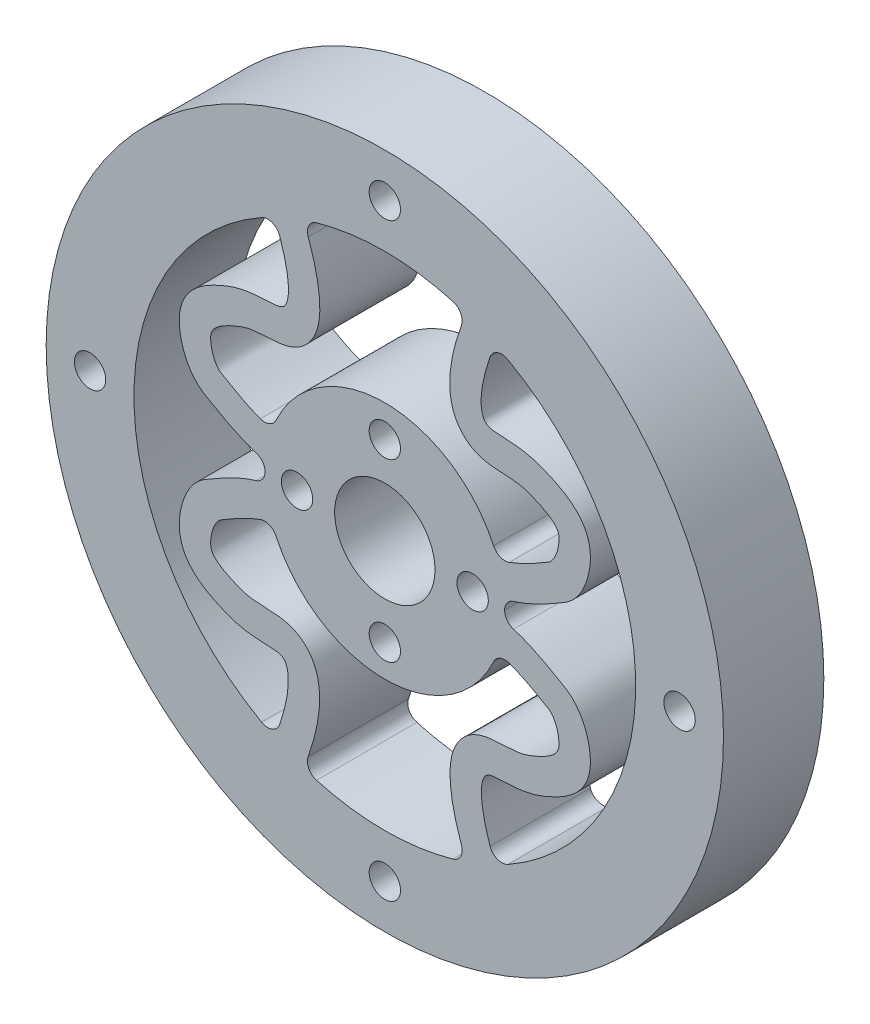
from build123d import *

# Parameters (mm, degrees)
BOSS_EXTRUDE1_OUTLINE_R   = 27
BOSS_EXTRUDE1_OUTLINE_R_2 = 1.25
BOSS_EXTRUDE1_OUTLINE_R_3 = 4
BOSS_EXTRUDE1_DEPTH       = 8
FILLET1_R                 = 1


# Read off the part's stored shape, not the designer's step: Boss-Extrude1
with BuildPart() as part:
    # Boss-Extrude1 outline → Boss-Extrude1 (new body)
    with BuildSketch(Plane.XY):
        Circle(BOSS_EXTRUDE1_OUTLINE_R)
        with Locations((0, -23.5)):
            Circle(BOSS_EXTRUDE1_OUTLINE_R_2, mode=Mode.SUBTRACT)
        with BuildLine():
            add(Edge.make_bspline(
                [(6.483801843, -18.919839155), (6.480612205, -18.912032776), (6.441503957, -18.816167051), (6.347612357, -18.58122213), (6.119029267, -17.980388927), (5.789810817, -17.013794353), (5.429669957, -15.668496809), (5.191806498, -14.230135337), (5.175407974, -12.761834066), (5.524401823, -11.283291588), (6.409718684, -10.166991751), (7.454125678, -9.625091073), (8.350033292, -9.42542645), (9.170309196, -9.376479516), (9.947678619, -9.350570154), (10.675240534, -9.288463207), (11.237211138, -9.169079776), (11.932036453, -8.89638821), (12.637697815, -8.576891164), (13.211834821, -8.233451201), (13.613150576, -7.882315625), (13.813065964, -7.569945647), (13.896838471, -7.281813359), (13.879539964, -6.641593544), (13.73039878, -6.059941379), (13.55175681, -5.653270156), (13.396702845, -5.396835282), (13.265283039, -5.238744867), (13.160626685, -5.14359219), (13.101918554, -5.098485448), (12.979648753, -5.022079201), (12.577995362, -4.7934595), (11.724742054, -4.291783433), (10.601060528, -3.730602471), (9.652508015, -3.377233049), (9.21951845, -3.260097231), (8.993066806, -3.214723866)],
                knots=[0.007762367, 0.007762367, 0.007762367, 0.007762367, 0.009702959, 0.03125, 0.0625, 0.125, 0.1875, 0.25, 0.3125, 0.375, 0.4375, 0.46875, 0.5, 0.53125, 0.5625, 0.59375, 0.625, 0.65625, 0.6875, 0.71875, 0.75, 0.78125, 0.8125, 0.84375, 0.875, 0.890625, 0.90625, 0.921875, 0.9296875, 0.9375, 0.9453125, 0.953125, 0.96875, 0.984375, 0.9921875, 1, 1, 1, 1], degree=3))
            ThreePointArc((6.483801843, -18.919839155), (0, -20), (-6.483801843, -18.919839155))
            add(Edge.make_bspline(
                [(-6.483801843, -18.919839155), (-6.480612205, -18.912032776), (-6.441503957, -18.816167051), (-6.347612357, -18.58122213), (-6.119029267, -17.980388927), (-5.789810817, -17.013794353), (-5.429669957, -15.668496809), (-5.191806498, -14.230135337), (-5.175407974, -12.761834066), (-5.524401823, -11.283291588), (-6.409718684, -10.166991751), (-7.454125678, -9.625091073), (-8.350033292, -9.42542645), (-9.170309196, -9.376479516), (-9.947678619, -9.350570154), (-10.675240534, -9.288463207), (-11.237211138, -9.169079776), (-11.932036453, -8.89638821), (-12.637697815, -8.576891164), (-13.211834821, -8.233451201), (-13.613150576, -7.882315625), (-13.813065964, -7.569945647), (-13.896838471, -7.281813359), (-13.879539964, -6.641593544), (-13.73039878, -6.059941379), (-13.55175681, -5.653270156), (-13.396702845, -5.396835282), (-13.265283039, -5.238744867), (-13.160626685, -5.14359219), (-13.101918554, -5.098485448), (-12.979648753, -5.022079201), (-12.577995362, -4.7934595), (-11.724742054, -4.291783433), (-10.601060528, -3.730602471), (-9.652508015, -3.377233049), (-9.21951845, -3.260097231), (-8.993066806, -3.214723866)],
                knots=[0.007762367, 0.007762367, 0.007762367, 0.007762367, 0.009702959, 0.03125, 0.0625, 0.125, 0.1875, 0.25, 0.3125, 0.375, 0.4375, 0.46875, 0.5, 0.53125, 0.5625, 0.59375, 0.625, 0.65625, 0.6875, 0.71875, 0.75, 0.78125, 0.8125, 0.84375, 0.875, 0.890625, 0.90625, 0.921875, 0.9296875, 0.9375, 0.9453125, 0.953125, 0.96875, 0.984375, 0.9921875, 1, 1, 1, 1], degree=3))
            ThreePointArc((-8.993066806, -3.214723866), (0, -9.550376962), (8.993066806, -3.214723866))
        make_face(mode=Mode.SUBTRACT)
        with Locations((0, -7)):
            Circle(BOSS_EXTRUDE1_OUTLINE_R_2, mode=Mode.SUBTRACT)
        with Locations((-23.5, 0)):
            Circle(BOSS_EXTRUDE1_OUTLINE_R_2, mode=Mode.SUBTRACT)
        with BuildLine():
            add(Edge.make_bspline(
                [(-8.793765965, -17.963008661), (-8.790561612, -17.955152681), (-8.757299555, -17.873459033), (-8.675456351, -17.668379774), (-8.473919568, -17.138762569), (-8.182262794, -16.281745106), (-7.874017475, -15.126473634), (-7.688580164, -13.981174059), (-7.68708969, -12.988779781), (-7.882450811, -12.340385911), (-8.105574911, -12.101711107), (-8.427286637, -11.936185887), (-9.255887466, -11.873584818), (-10.061993387, -11.846676872), (-10.980530297, -11.780784628), (-12.037855007, -11.548544014), (-12.901369588, -11.200056501), (-14.054290483, -10.681134366), (-15.231238441, -9.924658048), (-16.128927134, -8.661627788), (-16.433708137, -7.419671476), (-16.361750971, -6.266622794), (-16.068776901, -5.081044273), (-15.596575411, -4.134652828), (-15.106286502, -3.535992931), (-14.774613082, -3.227707308), (-14.488277389, -3.0127142), (-14.214236794, -2.847608081), (-13.840221024, -2.635292087), (-12.932474986, -2.101308455), (-11.383068607, -1.322241381), (-10.154677906, -0.901179774), (-9.522201544, -0.770857912), (-9.519265086, -0.770254719)],
                knots=[0.008782184, 0.008782184, 0.008782184, 0.008782184, 0.01097773, 0.03125, 0.0625, 0.125, 0.1875, 0.25, 0.3125, 0.375, 0.4375, 0.5, 0.53125, 0.5625, 0.59375, 0.625, 0.65625, 0.6875, 0.75, 0.78125, 0.8125, 0.84375, 0.875, 0.90625, 0.921875, 0.9296875, 0.9375, 0.9453125, 0.953125, 0.96875, 0.984375, 0.999644738, 0.99971579, 0.99971579, 0.99971579, 0.99971579], degree=3))
            ThreePointArc((-8.793765965, -17.963008661), (-20, 0), (-8.793765965, 17.963008661))
            add(Edge.make_bspline(
                [(-8.793765965, 17.963008661), (-8.792390185, 17.959667216), (-8.751090896, 17.859289875), (-8.659149113, 17.630898508), (-8.442492857, 17.062585707), (-8.150200233, 16.204626452), (-7.847022713, 15.063271185), (-7.669490667, 13.941546746), (-7.675936835, 12.977642097), (-7.87172167, 12.356105989), (-8.096556435, 12.116445797), (-8.437268015, 11.945555936), (-9.265970028, 11.877370514), (-10.069148732, 11.843745886), (-10.982990761, 11.771223658), (-12.032129114, 11.536768835), (-12.892956915, 11.190784402), (-14.04568893, 10.675396667), (-15.225024196, 9.924481098), (-16.127345354, 8.662487813), (-16.433024316, 7.418347937), (-16.360717665, 6.265882856), (-16.068019021, 5.080296428), (-15.595762735, 4.133827462), (-15.105222866, 3.535092161), (-14.773373049, 3.226801646), (-14.486865721, 3.011813821), (-14.212855625, 2.846812002), (-13.839019105, 2.634637657), (-12.931736587, 2.100862468), (-11.383019871, 1.3220545), (-10.15471139, 0.901122285), (-9.522198334, 0.770856958), (-9.519265086, 0.770254719)],
                knots=[0.003708072, 0.003708072, 0.003708072, 0.003708072, 0.00463509, 0.03125, 0.0625, 0.125, 0.1875, 0.25, 0.3125, 0.375, 0.4375, 0.5, 0.53125, 0.5625, 0.59375, 0.625, 0.65625, 0.6875, 0.75, 0.78125, 0.8125, 0.84375, 0.875, 0.90625, 0.921875, 0.9296875, 0.9375, 0.9453125, 0.953125, 0.96875, 0.984375, 0.999645143, 0.999716115, 0.999716115, 0.999716115, 0.999716115], degree=3))
            ThreePointArc((-9.519265086, 0.770254719), (-9.550376962, 0), (-9.519265086, -0.770254719))
        make_face(mode=Mode.SUBTRACT)
        with Locations((-7, 0)):
            Circle(BOSS_EXTRUDE1_OUTLINE_R_2, mode=Mode.SUBTRACT)
        Circle(BOSS_EXTRUDE1_OUTLINE_R_3, mode=Mode.SUBTRACT)
        with Locations((7, 0)):
            Circle(BOSS_EXTRUDE1_OUTLINE_R_2, mode=Mode.SUBTRACT)
        with Locations((0, 7)):
            Circle(BOSS_EXTRUDE1_OUTLINE_R_2, mode=Mode.SUBTRACT)
        with BuildLine():
            add(Edge.make_bspline(
                [(-6.483801843, 18.919839155), (-6.482428599, 18.916506133), (-6.435464145, 18.802446138), (-6.331751534, 18.544967686), (-6.088032516, 17.905633276), (-5.757506339, 16.936431605), (-5.401217095, 15.600475059), (-5.170938786, 14.177815551), (-5.164642087, 12.726303988), (-5.529593155, 11.262265681), (-6.422218406, 10.16816807), (-7.45697845, 9.636564412), (-8.34365536, 9.435395123), (-9.159513397, 9.380214885), (-9.934554469, 9.347855416), (-10.662113343, 9.280670847), (-11.229957293, 9.157678589), (-11.928251207, 8.884298538), (-12.636049231, 8.566038906), (-13.211909719, 8.224307826), (-13.613520282, 7.875254277), (-13.812127691, 7.566169682), (-13.895424665, 7.281234026), (-13.878139336, 6.639916023), (-13.729050873, 6.058586057), (-13.550532405, 5.652168502), (-13.395576418, 5.39596311), (-13.264221021, 5.238013923), (-13.159545079, 5.142897705), (-13.100787625, 5.097777089), (-12.978253874, 5.021254727), (-12.576385364, 4.792575773), (-11.723550617, 4.29110232), (-10.60055857, 3.730267544), (-9.65244952, 3.377137573), (-9.219480083, 3.260062194), (-8.993066806, 3.214723866)],
                knots=[0.003301299, 0.003301299, 0.003301299, 0.003301299, 0.004126624, 0.03125, 0.0625, 0.125, 0.1875, 0.25, 0.3125, 0.375, 0.4375, 0.46875, 0.5, 0.53125, 0.5625, 0.59375, 0.625, 0.65625, 0.6875, 0.71875, 0.75, 0.78125, 0.8125, 0.84375, 0.875, 0.890625, 0.90625, 0.921875, 0.9296875, 0.9375, 0.9453125, 0.953125, 0.96875, 0.984375, 0.9921875, 1, 1, 1, 1], degree=3))
            ThreePointArc((-6.483801843, 18.919839155), (0, 20), (6.483801843, 18.919839155))
            add(Edge.make_bspline(
                [(6.483801843, 18.919839155), (6.427558814, 18.784051049), (6.324537132, 18.529168098), (6.073882061, 17.871349196), (5.745428657, 16.907087807), (5.392085426, 15.577928796), (5.165001465, 14.161924058), (5.162032487, 12.716063833), (5.531376946, 11.256563451), (6.425565101, 10.168329975), (7.457974124, 9.63919877), (8.342543019, 9.437703347), (9.157376636, 9.381112059), (9.931882007, 9.347282574), (10.659445482, 9.278940922), (11.228646085, 9.155126895), (11.927746574, 8.881616393), (12.636043239, 8.56367028), (13.212306684, 8.222358626), (13.613990776, 7.873804728), (13.812299546, 7.565496628), (13.895496378, 7.281312129), (13.878231204, 6.639848031), (13.729136155, 6.05855138), (13.550624612, 5.652134143), (13.39567622, 5.395932335), (13.264328523, 5.237983984), (13.159663821, 5.142870471), (13.10090948, 5.097749149), (12.978423161, 5.021248624), (12.576606002, 4.792594285), (11.723719853, 4.29112662), (10.600636073, 3.730284389), (9.652465038, 3.377144046), (9.219486979, 3.260065429), (8.993066806, 3.214723866)],
                knots=[2.7542e-05, 2.7542e-05, 2.7542e-05, 2.7542e-05, 0.03125, 0.0625, 0.125, 0.1875, 0.25, 0.3125, 0.375, 0.4375, 0.46875, 0.5, 0.53125, 0.5625, 0.59375, 0.625, 0.65625, 0.6875, 0.71875, 0.75, 0.78125, 0.8125, 0.84375, 0.875, 0.890625, 0.90625, 0.921875, 0.9296875, 0.9375, 0.9453125, 0.953125, 0.96875, 0.984375, 0.9921875, 1, 1, 1, 1], degree=3))
            ThreePointArc((8.993066806, 3.214723866), (0, 9.550376962), (-8.993066806, 3.214723866))
        make_face(mode=Mode.SUBTRACT)
        with BuildLine():
            add(Edge.make_bspline(
                [(8.793765964, 17.963008661), (8.743696315, 17.842124252), (8.652024593, 17.615315229), (8.428556729, 17.028880945), (8.138535996, 16.176583266), (7.838516203, 15.04335892), (7.664046059, 13.930304494), (7.672917525, 12.974810129), (7.868875384, 12.359933936), (8.09461171, 12.119578752), (8.439880369, 11.947457623), (9.268619588, 11.87798157), (10.071117318, 11.842821716), (10.983851503, 11.768791985), (12.03106163, 11.533866993), (12.89126609, 11.188486281), (14.043949333, 10.673948938), (15.223811446, 9.924371515), (16.12718592, 8.662713201), (16.433111818, 7.418171723), (16.360730957, 6.265768417), (16.068051422, 5.080203116), (15.595819703, 4.133782126), (15.105329849, 3.535077718), (14.773513769, 3.226799381), (14.487046012, 3.011821514), (14.213025533, 2.846799467), (13.839137176, 2.634594588), (12.931786752, 2.100819871), (11.38089886, 1.320987455), (10.135468469, 0.896850952), (9.519264913, 0.770256852)],
                knots=[3.1817e-05, 3.1817e-05, 3.1817e-05, 3.1817e-05, 0.03125, 0.0625, 0.125, 0.1875, 0.25, 0.3125, 0.375, 0.4375, 0.5, 0.53125, 0.5625, 0.59375, 0.625, 0.65625, 0.6875, 0.75, 0.78125, 0.8125, 0.84375, 0.875, 0.90625, 0.921875, 0.9296875, 0.9375, 0.9453125, 0.953125, 0.96875, 0.984375, 0.99970761, 0.99970761, 0.99970761, 0.99970761], degree=3))
            ThreePointArc((8.793765964, 17.963008661), (20, 0), (8.793765965, -17.963008661))
            add(Edge.make_bspline(
                [(8.793765965, -17.963008661), (8.790561612, -17.955152681), (8.757299555, -17.873459033), (8.675456351, -17.668379774), (8.473919568, -17.138762569), (8.182262794, -16.281745106), (7.874017475, -15.126473634), (7.688580163, -13.981174059), (7.68708969, -12.988779781), (7.882450811, -12.340385911), (8.105574911, -12.101711107), (8.427286637, -11.936185887), (9.255887466, -11.873584818), (10.061993387, -11.846676872), (10.980530297, -11.780784628), (12.037855007, -11.548544014), (12.901369588, -11.200056501), (14.054290483, -10.681134366), (15.231238441, -9.924658048), (16.128927134, -8.661627788), (16.433708137, -7.419671476), (16.361750971, -6.266622794), (16.068776901, -5.081044273), (15.596575411, -4.134652828), (15.106286502, -3.535992931), (14.774613082, -3.227707308), (14.488277389, -3.0127142), (14.214236794, -2.847608081), (13.840221024, -2.635292087), (12.932474986, -2.101308455), (11.383068607, -1.322241381), (10.154677906, -0.901179774), (9.522201544, -0.770857912), (9.519265086, -0.770254719)],
                knots=[0.008782184, 0.008782184, 0.008782184, 0.008782184, 0.01097773, 0.03125, 0.0625, 0.125, 0.1875, 0.25, 0.3125, 0.375, 0.4375, 0.5, 0.53125, 0.5625, 0.59375, 0.625, 0.65625, 0.6875, 0.75, 0.78125, 0.8125, 0.84375, 0.875, 0.90625, 0.921875, 0.9296875, 0.9375, 0.9453125, 0.953125, 0.96875, 0.984375, 0.999644738, 0.99971579, 0.99971579, 0.99971579, 0.99971579], degree=3))
            ThreePointArc((9.519265086, -0.770254719), (9.550376962, 1.07e-06), (9.519264913, 0.770256852))
        make_face(mode=Mode.SUBTRACT)
        with Locations((23.5, 0)):
            Circle(BOSS_EXTRUDE1_OUTLINE_R_2, mode=Mode.SUBTRACT)
        with Locations((0, 23.5)):
            Circle(BOSS_EXTRUDE1_OUTLINE_R_2, mode=Mode.SUBTRACT)
    extrude(amount=BOSS_EXTRUDE1_DEPTH)

    # Fillet1
    fillet1_edges = [part.edges().sort_by_distance(p)[0] for p in [
        (8.993066806, 3.214723866, 4),
        (-8.993066806, 3.214723866, 4),
        (9.519264913, 0.770256852, 4),
        (9.519265086, -0.770254719, 4),
        (8.993066806, -3.214723866, 4),
        (-8.993066806, -3.214723866, 4),
        (-9.519265086, 0.770254719, 4),
        (-9.519265086, -0.770254719, 4),
        (6.483801843, -18.919839155, 4),
        (-8.793765965, -17.963008661, 4),
        (8.793765965, -17.963008661, 4),
        (6.483801843, 18.919839155, 4),
        (8.793765964, 17.963008661, 4),
        (-6.483801843, -18.919839155, 4),
        (-6.483801843, 18.919839155, 4),
        (-8.793765965, 17.963008661, 4),
    ]]
    fillet(fillet1_edges, radius=FILLET1_R)


solid = part.part
